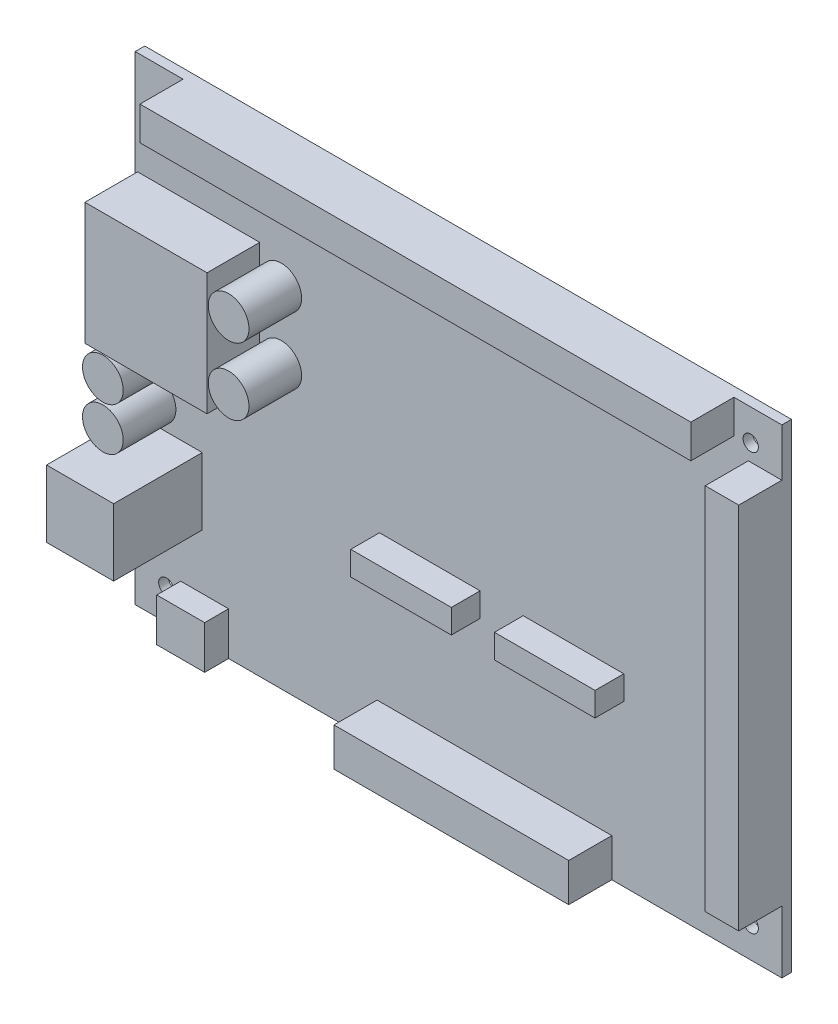
from build123d import *

# Parameters (mm, degrees)
SKETCH_1_W          = 135
SKETCH_1_H          = 100
SKETCH_1_R          = 1.6
EXTRUDE_1_DEPTH     = 2
SKETCH_2_W          = 10
SKETCH_2_H          = 9
EXTRUDE_2_DEPTH     = 5
SKETCH_3_W          = 115
SKETCH_3_H          = 7
EXTRUDE_3_DEPTH     = 9
SKETCH_4_W          = 7
SKETCH_4_H          = 77
EXTRUDE_4_DEPTH     = 9
SKETCH_5_W          = 49
SKETCH_5_H          = 8
EXTRUDE_5_DEPTH     = 9
SKETCH_6_W          = 25.5
SKETCH_6_H          = 25.5
EXTRUDE_6_DEPTH     = 11
SKETCH_6_5_R        = 4.25
EXTRUDE_10_DEPTH    = 11
SKETCH_6_6_W        = 14
SKETCH_6_6_H        = 14
EXTRUDE_11_DEPTH    = 18.5
SKETCH_8_W          = 21
SKETCH_8_H          = 5
EXTRUDE_12_DEPTH    = 6
SKETCH_9_W          = 7.4
SKETCH_9_H          = 3.2
CUT_EXTRUDE_1_DEPTH = 6


with BuildPart() as part:
    # 草图1 → 凸台-拉伸1 (new body)
    with BuildSketch(Plane.XY):
        with Locations((67.5, -50)):
            Rectangle(SKETCH_1_W, SKETCH_1_H)
        with Locations((6.5, -6.5)):
            Circle(SKETCH_1_R, mode=Mode.SUBTRACT)
        with Locations((128.5, -6.5)):
            Circle(SKETCH_1_R, mode=Mode.SUBTRACT)
        with Locations((6.5, -93.5)):
            Circle(SKETCH_1_R, mode=Mode.SUBTRACT)
        with Locations((128.5, -93.5)):
            Circle(SKETCH_1_R, mode=Mode.SUBTRACT)
    extrude(amount=EXTRUDE_1_DEPTH)

    # 草图2 → 凸台-拉伸2 (add)
    with BuildSketch(Plane.XY.offset(2)):
        with Locations((14.5, -95.5)):
            Rectangle(SKETCH_2_W, SKETCH_2_H)
    extrude(amount=EXTRUDE_2_DEPTH)

    # 草图3 → 凸台-拉伸3 (add)
    with BuildSketch(Plane.XY.offset(2)):
        with Locations((67.5, -3.5)):
            Rectangle(SKETCH_3_W, SKETCH_3_H)
    extrude(amount=EXTRUDE_3_DEPTH)

    # 草图4 → 凸台-拉伸4 (add)
    with BuildSketch(Plane.XY.offset(2)):
        with Locations((131.5, -48.5)):
            Rectangle(SKETCH_4_W, SKETCH_4_H)
    extrude(amount=EXTRUDE_4_DEPTH)

    # 草图5 → 凸台-拉伸5 (add)
    with BuildSketch(Plane.XY.offset(2)):
        with Locations((75, -96)):
            Rectangle(SKETCH_5_W, SKETCH_5_H)
    extrude(amount=EXTRUDE_5_DEPTH)

    # 草图6 → 凸台-拉伸6 (add)
    with BuildSketch(Plane.XY.offset(2)):
        with Locations((13.25, -34.25)):
            Rectangle(SKETCH_6_W, SKETCH_6_H)
    extrude(amount=EXTRUDE_6_DEPTH)

    # 草图6<5> → 凸台-拉伸10 (add)
    with BuildSketch(Plane.XY.offset(2)):
        with Locations((30.5, -27.25)):
            Circle(SKETCH_6_5_R)
        with Locations((30.5, -41.25)):
            Circle(SKETCH_6_5_R)
        with Locations((4.25, -60.5)):
            Circle(SKETCH_6_5_R)
        with Locations((4.25, -51.5)):
            Circle(SKETCH_6_5_R)
    extrude(amount=EXTRUDE_10_DEPTH)

    # 草图6<6> → 凸台-拉伸11 (add)
    with BuildSketch(Plane.XY.offset(2)):
        with Locations((7, -72.5)):
            Rectangle(SKETCH_6_6_W, SKETCH_6_6_H)
    extrude(amount=EXTRUDE_11_DEPTH)

    # 草图8 → 凸台-拉伸12 (add)
    with BuildSketch(Plane.XY.offset(2)):
        with Locations((61.5, -64)):
            Rectangle(SKETCH_8_W, SKETCH_8_H)
        with Locations((91.5, -64)):
            Rectangle(SKETCH_8_W, SKETCH_8_H)
    extrude(amount=EXTRUDE_12_DEPTH)

    # 草图9 → 切除-拉伸1 (cut)
    with BuildSketch(Plane.XZ.offset(100)):
        with Locations((14.5, 4.1)):
            Rectangle(SKETCH_9_W, SKETCH_9_H)
    extrude(amount=-CUT_EXTRUDE_1_DEPTH, mode=Mode.SUBTRACT)


solid = part.part
